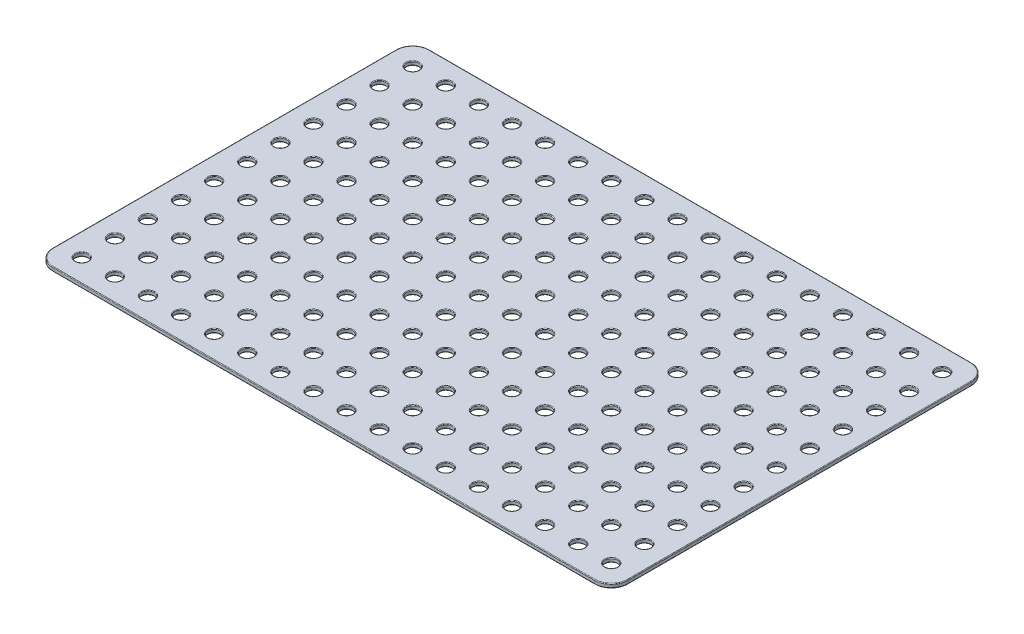
from build123d import *

# Parameters (mm, degrees)
EXTRUDE1_DEPTH       = 1.524
SKETCH2_R            = 2.413
CUT_EXTRUDE1_DEPTH   = 264.766847587
LPATTERN1_COUNT      = 17
LPATTERN1_PITCH      = 12.7
LPATTERN1_COUNT_DIR2 = 11
LPATTERN1_PITCH_DIR2 = 12.7
FILLET1_R            = 0.254


with BuildPart() as part:
    # Sketch1 → Extrude1 (new body)
    with BuildSketch(Plane(origin=(0, 0, 0), x_dir=(1, 0, 0), z_dir=(0, 1, 0))):
        with BuildLine():
            Line((6.35, 0), (214.3252, 0))
            ThreePointArc((214.3252, 0), (218.815328061, 1.859871939), (220.6752, 6.35))
            Line((220.6752, 6.35), (220.6752, 138.1252))
            ThreePointArc((220.6752, 138.1252), (218.815328061, 142.615328061), (214.3252, 144.4752))
            Line((214.3252, 144.4752), (6.35, 144.4752))
            ThreePointArc((6.35, 144.4752), (1.859871939, 142.615328061), (0, 138.1252))
            Line((0, 138.1252), (0, 6.35))
            ThreePointArc((0, 6.35), (1.859871939, 1.859871939), (6.35, 0))
        make_face()
    extrude(amount=EXTRUDE1_DEPTH)

    # Sketch2 → Cut-Extrude1 (cut, through all)
    with BuildSketch(Plane(origin=(0, 1.524, 0), x_dir=(-1, 0, 0), z_dir=(0, 1, 0))):
        with Locations((-8.7376, -8.7376)):
            Circle(SKETCH2_R)
    cut_extrude1 = extrude(amount=-CUT_EXTRUDE1_DEPTH, mode=Mode.SUBTRACT)

    # LPattern1: Cut-Extrude1 17 × 11
    with Locations(*[(i * LPATTERN1_PITCH, 0, -j * LPATTERN1_PITCH_DIR2) for i in range(LPATTERN1_COUNT) for j in range(LPATTERN1_COUNT_DIR2) if (i, j) != (0, 0)]):
        add(cut_extrude1, mode=Mode.SUBTRACT)

    # Fillet1
    fillet1_edges = [part.edges().sort_by_distance(p)[0] for p in [
        (201.6506, 0, -123.0376),
        (188.9506, 0, -123.0376),
        (176.2506, 0, -123.0376),
        (163.5506, 0, -123.0376),
        (150.8506, 0, -123.0376),
        (138.1506, 0, -123.0376),
        (125.4506, 0, -123.0376),
        (112.7506, 0, -123.0376),
        (100.0506, 0, -123.0376),
        (87.3506, 0, -123.0376),
        (74.6506, 0, -123.0376),
        (61.9506, 0, -123.0376),
        (49.2506, 0, -123.0376),
        (36.5506, 0, -123.0376),
        (23.8506, 0, -123.0376),
        (201.6506, 0, -110.3376),
        (188.9506, 0, -110.3376),
        (176.2506, 0, -110.3376),
        (163.5506, 0, -110.3376),
        (150.8506, 0, -110.3376),
        (138.1506, 0, -110.3376),
        (125.4506, 0, -110.3376),
        (112.7506, 0, -110.3376),
        (100.0506, 0, -110.3376),
        (87.3506, 0, -110.3376),
        (74.6506, 0, -110.3376),
        (61.9506, 0, -110.3376),
        (49.2506, 0, -110.3376),
        (36.5506, 0, -110.3376),
        (23.8506, 0, -110.3376),
        (201.6506, 0, -97.6376),
        (188.9506, 0, -97.6376),
        (176.2506, 0, -97.6376),
        (163.5506, 0, -97.6376),
        (150.8506, 0, -97.6376),
        (138.1506, 0, -97.6376),
        (125.4506, 0, -97.6376),
        (112.7506, 0, -97.6376),
        (100.0506, 0, -97.6376),
        (87.3506, 0, -97.6376),
        (74.6506, 0, -97.6376),
        (61.9506, 0, -97.6376),
        (49.2506, 0, -97.6376),
        (36.5506, 0, -97.6376),
        (23.8506, 0, -97.6376),
        (201.6506, 0, -84.9376),
        (188.9506, 0, -84.9376),
        (176.2506, 0, -84.9376),
        (163.5506, 0, -84.9376),
        (150.8506, 0, -84.9376),
        (138.1506, 0, -84.9376),
        (125.4506, 0, -84.9376),
        (112.7506, 0, -84.9376),
        (100.0506, 0, -84.9376),
        (87.3506, 0, -84.9376),
        (74.6506, 0, -84.9376),
        (61.9506, 0, -84.9376),
        (49.2506, 0, -84.9376),
        (36.5506, 0, -84.9376),
        (23.8506, 0, -84.9376),
        (201.6506, 0, -72.2376),
        (188.9506, 0, -72.2376),
        (176.2506, 0, -72.2376),
        (163.5506, 0, -72.2376),
        (150.8506, 0, -72.2376),
        (138.1506, 0, -72.2376),
        (125.4506, 0, -72.2376),
        (112.7506, 0, -72.2376),
        (100.0506, 0, -72.2376),
        (87.3506, 0, -72.2376),
        (74.6506, 0, -72.2376),
        (61.9506, 0, -72.2376),
        (49.2506, 0, -72.2376),
        (36.5506, 0, -72.2376),
        (23.8506, 0, -72.2376),
        (201.6506, 0, -59.5376),
        (188.9506, 0, -59.5376),
        (176.2506, 0, -59.5376),
        (163.5506, 0, -59.5376),
        (150.8506, 0, -59.5376),
        (138.1506, 0, -59.5376),
        (125.4506, 0, -59.5376),
        (112.7506, 0, -59.5376),
        (100.0506, 0, -59.5376),
        (87.3506, 0, -59.5376),
        (74.6506, 0, -59.5376),
        (61.9506, 0, -59.5376),
        (49.2506, 0, -59.5376),
        (36.5506, 0, -59.5376),
        (23.8506, 0, -59.5376),
        (201.6506, 0, -46.8376),
        (188.9506, 0, -46.8376),
        (176.2506, 0, -46.8376),
        (163.5506, 0, -46.8376),
        (150.8506, 0, -46.8376),
        (138.1506, 0, -46.8376),
        (125.4506, 0, -46.8376),
        (112.7506, 0, -46.8376),
        (100.0506, 0, -46.8376),
        (87.3506, 0, -46.8376),
        (74.6506, 0, -46.8376),
        (61.9506, 0, -46.8376),
        (49.2506, 0, -46.8376),
        (36.5506, 0, -46.8376),
        (23.8506, 0, -46.8376),
        (201.6506, 0, -34.1376),
        (188.9506, 0, -34.1376),
        (176.2506, 0, -34.1376),
        (163.5506, 0, -34.1376),
        (150.8506, 0, -34.1376),
        (138.1506, 0, -34.1376),
        (125.4506, 0, -34.1376),
        (112.7506, 0, -34.1376),
        (100.0506, 0, -34.1376),
        (87.3506, 0, -34.1376),
        (74.6506, 0, -34.1376),
        (61.9506, 0, -34.1376),
        (49.2506, 0, -34.1376),
        (36.5506, 0, -34.1376),
        (23.8506, 0, -34.1376),
        (201.6506, 0, -21.4376),
        (188.9506, 0, -21.4376),
        (176.2506, 0, -21.4376),
        (163.5506, 0, -21.4376),
        (150.8506, 0, -21.4376),
        (138.1506, 0, -21.4376),
        (125.4506, 0, -21.4376),
        (112.7506, 0, -21.4376),
        (100.0506, 0, -21.4376),
        (87.3506, 0, -21.4376),
        (74.6506, 0, -21.4376),
        (61.9506, 0, -21.4376),
        (49.2506, 0, -21.4376),
        (36.5506, 0, -21.4376),
        (0, 0, -72.2376),
        (1.859871939, 0, -1.859871939),
        (110.3376, 0, 0),
        (218.815328061, 0, -1.859871939),
        (220.6752, 0, -72.2376),
        (218.815328061, 0, -142.615328061),
        (110.3376, 0, -144.4752),
        (1.859871939, 0, -142.615328061),
        (11.1506, 0, -8.7376),
        (23.8506, 0, -21.4376),
        (11.1506, 0, -21.4376),
        (11.1506, 0, -34.1376),
        (11.1506, 0, -46.8376),
        (11.1506, 0, -59.5376),
        (11.1506, 0, -72.2376),
        (11.1506, 0, -84.9376),
        (11.1506, 0, -97.6376),
        (11.1506, 0, -110.3376),
        (11.1506, 0, -123.0376),
        (11.1506, 0, -135.7376),
        (23.8506, 0, -8.7376),
        (23.8506, 0, -135.7376),
        (36.5506, 0, -8.7376),
        (36.5506, 0, -135.7376),
        (49.2506, 0, -8.7376),
        (49.2506, 0, -135.7376),
        (61.9506, 0, -8.7376),
        (61.9506, 0, -135.7376),
        (74.6506, 0, -8.7376),
        (74.6506, 0, -135.7376),
        (87.3506, 0, -8.7376),
        (87.3506, 0, -135.7376),
        (100.0506, 0, -8.7376),
        (100.0506, 0, -135.7376),
        (112.7506, 0, -8.7376),
        (112.7506, 0, -135.7376),
        (125.4506, 0, -8.7376),
        (125.4506, 0, -135.7376),
        (138.1506, 0, -8.7376),
        (138.1506, 0, -135.7376),
        (150.8506, 0, -8.7376),
        (150.8506, 0, -135.7376),
        (163.5506, 0, -8.7376),
        (163.5506, 0, -135.7376),
        (176.2506, 0, -8.7376),
        (176.2506, 0, -135.7376),
        (188.9506, 0, -8.7376),
        (188.9506, 0, -135.7376),
        (201.6506, 0, -8.7376),
        (201.6506, 0, -135.7376),
        (214.3506, 0, -8.7376),
        (214.3506, 0, -21.4376),
        (214.3506, 0, -34.1376),
        (214.3506, 0, -46.8376),
        (214.3506, 0, -59.5376),
        (214.3506, 0, -72.2376),
        (214.3506, 0, -84.9376),
        (214.3506, 0, -97.6376),
        (214.3506, 0, -110.3376),
        (214.3506, 0, -123.0376),
        (214.3506, 0, -135.7376),
        (201.6506, 1.524, -123.0376),
        (188.9506, 1.524, -123.0376),
        (176.2506, 1.524, -123.0376),
        (163.5506, 1.524, -123.0376),
        (150.8506, 1.524, -123.0376),
        (138.1506, 1.524, -123.0376),
        (125.4506, 1.524, -123.0376),
        (112.7506, 1.524, -123.0376),
        (100.0506, 1.524, -123.0376),
        (87.3506, 1.524, -123.0376),
        (74.6506, 1.524, -123.0376),
        (61.9506, 1.524, -123.0376),
        (49.2506, 1.524, -123.0376),
        (36.5506, 1.524, -123.0376),
        (23.8506, 1.524, -123.0376),
        (201.6506, 1.524, -110.3376),
        (188.9506, 1.524, -110.3376),
        (176.2506, 1.524, -110.3376),
        (163.5506, 1.524, -110.3376),
        (150.8506, 1.524, -110.3376),
        (138.1506, 1.524, -110.3376),
        (125.4506, 1.524, -110.3376),
        (112.7506, 1.524, -110.3376),
        (100.0506, 1.524, -110.3376),
        (87.3506, 1.524, -110.3376),
        (74.6506, 1.524, -110.3376),
        (61.9506, 1.524, -110.3376),
        (49.2506, 1.524, -110.3376),
        (36.5506, 1.524, -110.3376),
        (23.8506, 1.524, -110.3376),
        (201.6506, 1.524, -97.6376),
        (188.9506, 1.524, -97.6376),
        (176.2506, 1.524, -97.6376),
        (163.5506, 1.524, -97.6376),
        (150.8506, 1.524, -97.6376),
        (138.1506, 1.524, -97.6376),
        (125.4506, 1.524, -97.6376),
        (112.7506, 1.524, -97.6376),
        (100.0506, 1.524, -97.6376),
        (87.3506, 1.524, -97.6376),
        (74.6506, 1.524, -97.6376),
        (61.9506, 1.524, -97.6376),
        (49.2506, 1.524, -97.6376),
        (36.5506, 1.524, -97.6376),
        (23.8506, 1.524, -97.6376),
        (201.6506, 1.524, -84.9376),
        (188.9506, 1.524, -84.9376),
        (176.2506, 1.524, -84.9376),
        (163.5506, 1.524, -84.9376),
        (150.8506, 1.524, -84.9376),
        (138.1506, 1.524, -84.9376),
        (125.4506, 1.524, -84.9376),
        (112.7506, 1.524, -84.9376),
        (100.0506, 1.524, -84.9376),
        (87.3506, 1.524, -84.9376),
        (74.6506, 1.524, -84.9376),
        (61.9506, 1.524, -84.9376),
        (49.2506, 1.524, -84.9376),
        (36.5506, 1.524, -84.9376),
        (23.8506, 1.524, -84.9376),
        (201.6506, 1.524, -72.2376),
        (188.9506, 1.524, -72.2376),
        (176.2506, 1.524, -72.2376),
        (163.5506, 1.524, -72.2376),
        (150.8506, 1.524, -72.2376),
        (138.1506, 1.524, -72.2376),
        (125.4506, 1.524, -72.2376),
        (112.7506, 1.524, -72.2376),
        (100.0506, 1.524, -72.2376),
        (87.3506, 1.524, -72.2376),
        (74.6506, 1.524, -72.2376),
        (61.9506, 1.524, -72.2376),
        (49.2506, 1.524, -72.2376),
        (36.5506, 1.524, -72.2376),
        (23.8506, 1.524, -72.2376),
        (201.6506, 1.524, -59.5376),
        (188.9506, 1.524, -59.5376),
        (176.2506, 1.524, -59.5376),
        (163.5506, 1.524, -59.5376),
        (150.8506, 1.524, -59.5376),
        (138.1506, 1.524, -59.5376),
        (125.4506, 1.524, -59.5376),
        (112.7506, 1.524, -59.5376),
        (100.0506, 1.524, -59.5376),
        (87.3506, 1.524, -59.5376),
        (74.6506, 1.524, -59.5376),
        (61.9506, 1.524, -59.5376),
        (49.2506, 1.524, -59.5376),
        (36.5506, 1.524, -59.5376),
        (23.8506, 1.524, -59.5376),
        (201.6506, 1.524, -46.8376),
        (188.9506, 1.524, -46.8376),
        (176.2506, 1.524, -46.8376),
        (163.5506, 1.524, -46.8376),
        (150.8506, 1.524, -46.8376),
        (138.1506, 1.524, -46.8376),
        (125.4506, 1.524, -46.8376),
        (112.7506, 1.524, -46.8376),
        (100.0506, 1.524, -46.8376),
        (87.3506, 1.524, -46.8376),
        (74.6506, 1.524, -46.8376),
        (61.9506, 1.524, -46.8376),
        (49.2506, 1.524, -46.8376),
        (36.5506, 1.524, -46.8376),
        (23.8506, 1.524, -46.8376),
        (201.6506, 1.524, -34.1376),
        (188.9506, 1.524, -34.1376),
        (176.2506, 1.524, -34.1376),
        (163.5506, 1.524, -34.1376),
        (150.8506, 1.524, -34.1376),
        (138.1506, 1.524, -34.1376),
        (125.4506, 1.524, -34.1376),
        (112.7506, 1.524, -34.1376),
        (100.0506, 1.524, -34.1376),
        (87.3506, 1.524, -34.1376),
        (74.6506, 1.524, -34.1376),
        (61.9506, 1.524, -34.1376),
        (49.2506, 1.524, -34.1376),
        (36.5506, 1.524, -34.1376),
        (23.8506, 1.524, -34.1376),
        (201.6506, 1.524, -21.4376),
        (188.9506, 1.524, -21.4376),
        (176.2506, 1.524, -21.4376),
        (163.5506, 1.524, -21.4376),
        (150.8506, 1.524, -21.4376),
        (138.1506, 1.524, -21.4376),
        (125.4506, 1.524, -21.4376),
        (112.7506, 1.524, -21.4376),
        (100.0506, 1.524, -21.4376),
        (87.3506, 1.524, -21.4376),
        (74.6506, 1.524, -21.4376),
        (61.9506, 1.524, -21.4376),
        (49.2506, 1.524, -21.4376),
        (36.5506, 1.524, -21.4376),
        (110.3376, 1.524, -144.4752),
        (218.815328061, 1.524, -142.615328061),
        (220.6752, 1.524, -72.2376),
        (218.815328061, 1.524, -1.859871939),
        (110.3376, 1.524, 0),
        (1.859871939, 1.524, -1.859871939),
        (0, 1.524, -72.2376),
        (1.859871939, 1.524, -142.615328061),
        (11.1506, 1.524, -8.7376),
        (23.8506, 1.524, -21.4376),
        (11.1506, 1.524, -21.4376),
        (11.1506, 1.524, -34.1376),
        (11.1506, 1.524, -46.8376),
        (11.1506, 1.524, -59.5376),
        (11.1506, 1.524, -72.2376),
        (11.1506, 1.524, -84.9376),
        (11.1506, 1.524, -97.6376),
        (11.1506, 1.524, -110.3376),
        (11.1506, 1.524, -123.0376),
        (11.1506, 1.524, -135.7376),
        (23.8506, 1.524, -8.7376),
        (23.8506, 1.524, -135.7376),
        (36.5506, 1.524, -8.7376),
        (36.5506, 1.524, -135.7376),
        (49.2506, 1.524, -8.7376),
        (49.2506, 1.524, -135.7376),
        (61.9506, 1.524, -8.7376),
        (61.9506, 1.524, -135.7376),
        (74.6506, 1.524, -8.7376),
        (74.6506, 1.524, -135.7376),
        (87.3506, 1.524, -8.7376),
        (87.3506, 1.524, -135.7376),
        (100.0506, 1.524, -8.7376),
        (100.0506, 1.524, -135.7376),
        (112.7506, 1.524, -8.7376),
        (112.7506, 1.524, -135.7376),
        (125.4506, 1.524, -8.7376),
        (125.4506, 1.524, -135.7376),
        (138.1506, 1.524, -8.7376),
        (138.1506, 1.524, -135.7376),
        (150.8506, 1.524, -8.7376),
        (150.8506, 1.524, -135.7376),
        (163.5506, 1.524, -8.7376),
        (163.5506, 1.524, -135.7376),
        (176.2506, 1.524, -8.7376),
        (176.2506, 1.524, -135.7376),
        (188.9506, 1.524, -8.7376),
        (188.9506, 1.524, -135.7376),
        (201.6506, 1.524, -8.7376),
        (201.6506, 1.524, -135.7376),
        (214.3506, 1.524, -8.7376),
        (214.3506, 1.524, -21.4376),
        (214.3506, 1.524, -34.1376),
        (214.3506, 1.524, -46.8376),
        (214.3506, 1.524, -59.5376),
        (214.3506, 1.524, -72.2376),
        (214.3506, 1.524, -84.9376),
        (214.3506, 1.524, -97.6376),
        (214.3506, 1.524, -110.3376),
        (214.3506, 1.524, -123.0376),
        (214.3506, 1.524, -135.7376),
    ]]
    fillet(fillet1_edges, radius=FILLET1_R)


solid = part.part
